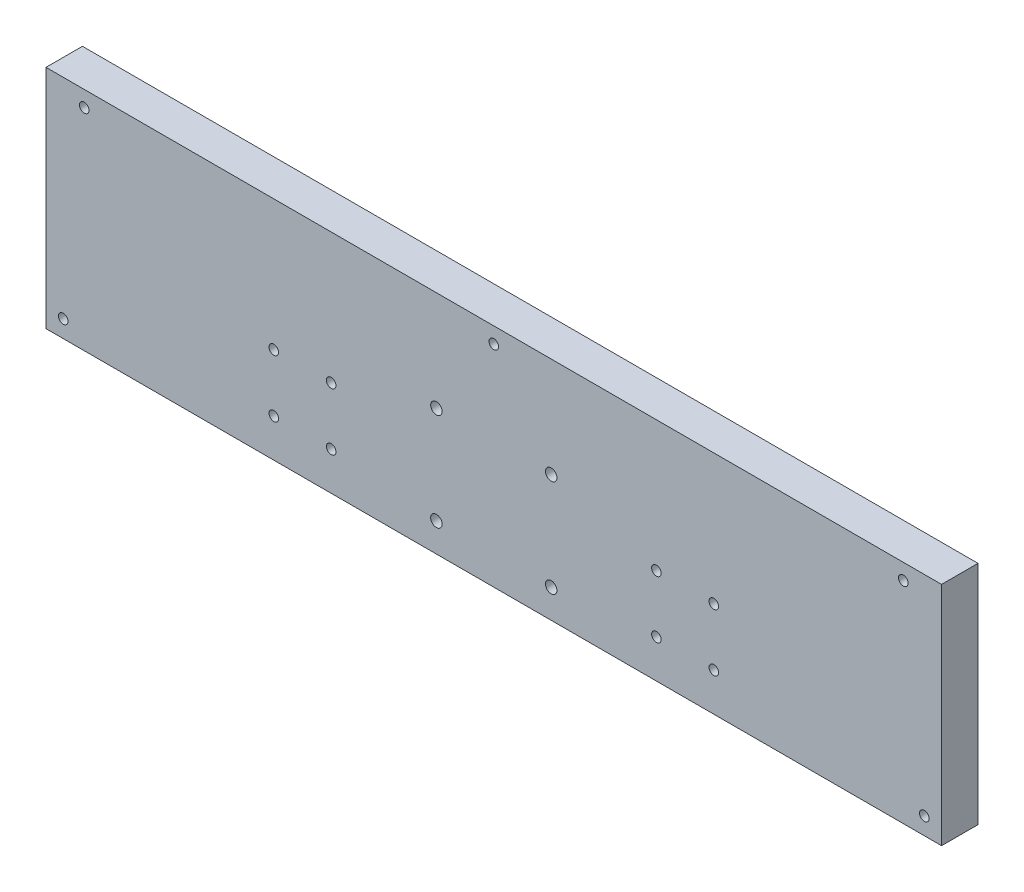
from build123d import *

# Parameters (mm, degrees)
SKETCH1_W                = 468.1
SKETCH1_H                = 118.3
BOSS_EXTRUDE1_DEPTH      = 19.05
M5_CLEARANCE_HOLE1_D     = 5
M5_CLEARANCE_HOLE1_DEPTH = 28.497848452
M5_CLEARANCE_HOLE1_TIP   = 1.502151548
M5_CLEARANCE_HOLE2_D     = 6
M5_CLEARANCE_HOLE2_DEPTH = 28.197418143
M5_CLEARANCE_HOLE2_TIP   = 1.802581857


with BuildPart() as part:
    # Sketch1 → Boss-Extrude1 (new body)
    with BuildSketch(Plane.XY):
        with Locations((0, 59.15)):
            Rectangle(SKETCH1_W, SKETCH1_H)
    extrude(amount=BOSS_EXTRUDE1_DEPTH)

    # M5 Clearance Hole1
    with Locations(Plane(origin=(0, 0, 0), x_dir=(-1, 0, 0), z_dir=(0, 0, -1))):
        with Locations((-115, 20), (-115, 50), (-85, 50), (-85, 20), (85, 20), (85, 50), (115, 50), (115, 20), (214.05, 110.05), (0, 110.05), (-214.05, 110.05), (-225.05, 9), (225.05, 9)):
            Hole(M5_CLEARANCE_HOLE1_D / 2, depth=M5_CLEARANCE_HOLE1_DEPTH)
            with Locations((0, 0, -(M5_CLEARANCE_HOLE1_DEPTH + M5_CLEARANCE_HOLE1_TIP / 2))):  # 118° drill point
                Cone(0, M5_CLEARANCE_HOLE1_D / 2, M5_CLEARANCE_HOLE1_TIP, mode=Mode.SUBTRACT)

    # M5 Clearance Hole2
    with Locations(Plane(origin=(0, 0, 0), x_dir=(-1, 0, 0), z_dir=(0, 0, -1))):
        with Locations((30, 15), (30, 66), (-30, 15), (-30, 66)):
            Hole(M5_CLEARANCE_HOLE2_D / 2, depth=M5_CLEARANCE_HOLE2_DEPTH)
            with Locations((0, 0, -(M5_CLEARANCE_HOLE2_DEPTH + M5_CLEARANCE_HOLE2_TIP / 2))):  # 118° drill point
                Cone(0, M5_CLEARANCE_HOLE2_D / 2, M5_CLEARANCE_HOLE2_TIP, mode=Mode.SUBTRACT)


solid = part.part
